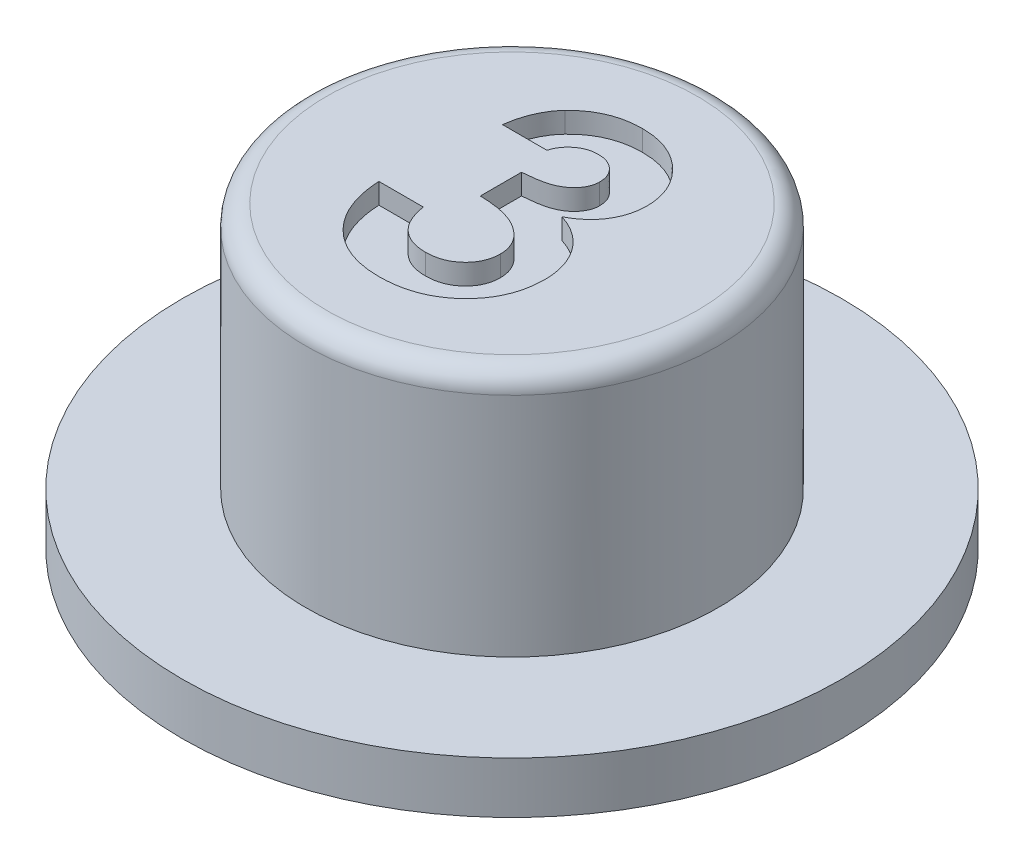
from build123d import *

# Parameters (mm, degrees)
SKETCH2_W          = 2.5
SKETCH2_H          = 3.5
CUT_EXTRUDE1_DEPTH = 3.5
FILLET1_R          = 0.5
CUT_EXTRUDE2_DEPTH = 0.5


with BuildPart() as part:
    # Sketch1 → Revolve1 (revolve)
    with BuildSketch(Plane.XY):
        Polygon((0, 7.25), (5, 7.25), (5, 1.25), (8, 1.25), (8, 0), (0, 0), align=None)
    revolve(axis=Axis((0, 7.25, 0), (0, -1, 0)))

    # Sketch2 → Cut-Extrude1 (cut)
    with BuildSketch(Plane.XZ):
        Rectangle(SKETCH2_W, SKETCH2_H)
    extrude(amount=-CUT_EXTRUDE1_DEPTH, mode=Mode.SUBTRACT)

    # Fillet1
    fillet1_edges = [part.edges().sort_by_distance(p)[0] for p in [
        (-5, 7.25, 0),
    ]]
    fillet(fillet1_edges, radius=FILLET1_R)

    # Sketch3 → Cut-Extrude2 (cut)
    with BuildSketch(Plane(origin=(0, 7.25, 0), x_dir=(1, 0, 0), z_dir=(0, 1, 0))):
        with BuildLine():
            Line((-0.692307692, 1.538461538), (-1.769230769, 1.538461538))
            add(Edge.make_bspline(
                [(-1.769230769, 1.538461538), (-1.761627283, 1.592293081), (-1.746721151, 1.697826255), (-1.711052772, 1.850612001), (-1.668389541, 1.995539737), (-1.615126677, 2.132150507), (-1.552658003, 2.26068766), (-1.481618755, 2.381592272), (-1.401240972, 2.494345399), (-1.339630551, 2.56226833), (-1.308894231, 2.596153846)],
                knots=[0, 0, 0, 0, 1.111473889, 2.178970933, 3.205615836, 4.199322666, 5.174200091, 6.12565194, 7.064921805, 8, 8, 8, 8], degree=3))
            add(Edge.make_bspline(
                [(-1.308894231, 2.596153846), (-1.264561162, 2.64086333), (-1.177185342, 2.728981023), (-1.0311701, 2.841850054), (-0.87811916, 2.939530525), (-0.714963019, 3.016972309), (-0.54424051, 3.079652462), (-0.364593988, 3.121754862), (-0.176757553, 3.149690176), (-0.048582817, 3.152441902), (0.016826923, 3.153846154)],
                knots=[0, 0, 0, 0, 1.01925491, 2.00884431, 2.983262333, 3.955970413, 4.92937149, 5.924503185, 6.940838805, 8, 8, 8, 8], degree=3))
            add(Edge.make_bspline(
                [(0.016826923, 3.153846154), (0.074979548, 3.152473284), (0.189295889, 3.1497745), (0.357312147, 3.12811012), (0.517501588, 3.09011321), (0.671557461, 3.040433102), (0.817214107, 2.972835014), (0.957686309, 2.894368021), (1.089049269, 2.798124993), (1.21161035, 2.689380057), (1.324206079, 2.571761763), (1.421714474, 2.44603748), (1.50554419, 2.315565593), (1.574608788, 2.179262127), (1.627710079, 2.03689644), (1.66456395, 1.889290961), (1.688685703, 1.73677139), (1.69108886, 1.633105893), (1.692307692, 1.580528846)],
                knots=[0, 0, 0, 0, 1.091422571, 2.145516843, 3.172569842, 4.178562979, 5.178154469, 6.181868002, 7.194278174, 8.227918432, 9.254613415, 10.245994977, 11.209837596, 12.161663635, 13.10878368, 14.055455738, 15.013766427, 16, 16, 16, 16], degree=3))
            add(Edge.make_bspline(
                [(1.692307692, 1.580528846), (1.689806575, 1.515416552), (1.684882644, 1.387230464), (1.644478223, 1.1996206), (1.581234318, 1.02023209), (1.489872345, 0.851574848), (1.37564661, 0.694107866), (1.235495458, 0.553095736), (1.073410758, 0.42632758), (0.951731615, 0.358202358), (0.889423077, 0.323317308)],
                knots=[0, 0, 0, 0, 0.992805628, 1.954529043, 2.915727527, 3.886831945, 4.871318353, 5.87440735, 6.911542536, 8, 8, 8, 8], degree=3))
            add(Edge.make_bspline(
                [(0.889423077, 0.323317308), (0.932190702, 0.309275796), (1.016227167, 0.281684855), (1.135674897, 0.227344809), (1.249256039, 0.167960147), (1.355014768, 0.098970823), (1.45400298, 0.02316646), (1.545617233, -0.060100944), (1.6304049, -0.150649828), (1.706981857, -0.248978177), (1.774946898, -0.353513419), (1.83592831, -0.461840853), (1.886119412, -0.575603284), (1.928637524, -0.693501468), (1.961008393, -0.816595012), (1.983800378, -0.944406938), (1.996974705, -1.0766457), (1.998984014, -1.166237381), (2, -1.211538462)],
                knots=[0, 0, 0, 0, 1.059543567, 2.081955587, 3.086750234, 4.076226789, 5.052108497, 6.020845489, 6.989030705, 7.970690546, 8.952259656, 9.923888338, 10.895517021, 11.877585046, 12.873342345, 13.889638361, 14.932918083, 16, 16, 16, 16], degree=3))
            add(Edge.make_bspline(
                [(2, -1.211538462), (1.99794046, -1.278112657), (1.993879466, -1.409383412), (1.96806157, -1.602731801), (1.919993298, -1.787072311), (1.856756824, -1.964526059), (1.772406231, -2.132802181), (1.673139763, -2.295762385), (1.55112133, -2.447755255), (1.415518792, -2.59279909), (1.264924269, -2.72466645), (1.101655307, -2.838989517), (0.92930205, -2.937099049), (0.746774068, -3.016747163), (0.554134775, -3.07808532), (0.351813548, -3.122423367), (0.138960288, -3.149550117), (-0.006328716, -3.152393843), (-0.080528846, -3.153846154)],
                knots=[0, 0, 0, 0, 1.005138573, 1.981928558, 2.936866704, 3.876260664, 4.820238198, 5.773547, 6.751179199, 7.756627054, 8.768222608, 9.766606018, 10.760583154, 11.757261445, 12.767156078, 13.807575856, 14.880313354, 16, 16, 16, 16], degree=3))
            add(Edge.make_bspline(
                [(-0.080528846, -3.153846154), (-0.150720973, -3.152314938), (-0.287972388, -3.149320847), (-0.488731308, -3.123405473), (-0.679533658, -3.081601873), (-0.860866369, -3.022676231), (-1.032027879, -2.946259745), (-1.194570348, -2.855264855), (-1.345250276, -2.744443189), (-1.485746535, -2.618797446), (-1.612942493, -2.477830056), (-1.726625726, -2.324806459), (-1.824289498, -2.15914477), (-1.90633433, -1.981552763), (-1.972118816, -1.791718889), (-2.024009425, -1.590029185), (-2.060255866, -1.376089611), (-2.071294795, -1.228894633), (-2.076923077, -1.153846154)],
                knots=[0, 0, 0, 0, 1.066544725, 2.085487077, 3.070979577, 4.031932826, 4.977951092, 5.916076795, 6.857635327, 7.814973522, 8.776389752, 9.738577119, 10.707772778, 11.69409279, 12.707140348, 13.757286496, 14.856535458, 16, 16, 16, 16], degree=3))
            Line((-2.076923077, -1.153846154), (-1, -1.153846154))
            add(Edge.make_bspline(
                [(-1, -1.153846154), (-0.993175651, -1.191581514), (-0.979883441, -1.265081025), (-0.953957801, -1.371491977), (-0.920173075, -1.469715859), (-0.881109526, -1.56062568), (-0.838915012, -1.645415056), (-0.78793395, -1.720952506), (-0.731901962, -1.78928918), (-0.651047396, -1.870528571), (-0.535460225, -1.953998654), (-0.37937925, -2.026538127), (-0.205753946, -2.069055171), (-0.084372543, -2.074242119), (-0.021634615, -2.076923077)],
                knots=[0, 0, 0, 0, 0.928156231, 1.807827665, 2.648129825, 3.438902246, 4.202261636, 4.936546065, 5.639352463, 6.338805438, 7.70633318, 9.064371875, 10.482673459, 12, 12, 12, 12], degree=3))
            add(Edge.make_bspline(
                [(-0.021634615, -2.076923077), (0.011656347, -2.076352192), (0.076865893, -2.075233957), (0.172649007, -2.062839815), (0.26389591, -2.042426653), (0.350776553, -2.014685923), (0.433844025, -1.979911184), (0.511511237, -1.935071238), (0.585361242, -1.8829384), (0.654591223, -1.824327251), (0.718561152, -1.760462079), (0.771787895, -1.689742251), (0.820433287, -1.617878267), (0.856411769, -1.54016853), (0.88793667, -1.460794654), (0.90723152, -1.376875618), (0.921800518, -1.290171816), (0.92264721, -1.23083554), (0.923076923, -1.200721154)],
                knots=[0, 0, 0, 0, 1.110435564, 2.175094844, 3.216326037, 4.226890168, 5.215276772, 6.21526065, 7.213097102, 8.228249917, 9.239874822, 10.221364777, 11.178138315, 12.128914389, 13.072518965, 14.022636769, 14.996447288, 16, 16, 16, 16], degree=3))
            add(Edge.make_bspline(
                [(0.923076923, -1.200721154), (0.921936114, -1.167785942), (0.919665025, -1.102219481), (0.901109988, -1.006539018), (0.871807663, -0.914502124), (0.831103154, -0.826516381), (0.776746819, -0.742906088), (0.71260695, -0.66199377), (0.633630386, -0.587990767), (0.546982519, -0.514841041), (0.446505033, -0.451076542), (0.337091322, -0.392231279), (0.215865824, -0.345408616), (0.085787762, -0.303587306), (-0.055603411, -0.27304167), (-0.207429711, -0.250862562), (-0.369446217, -0.234353653), (-0.481126301, -0.231985178), (-0.538461538, -0.230769231)],
                knots=[0, 0, 0, 0, 0.809814727, 1.612155564, 2.388397, 3.182215007, 3.988903953, 4.837162975, 5.715530372, 6.646997145, 7.623086902, 8.637258368, 9.698941581, 10.815059213, 11.996518529, 13.252603015, 14.589518788, 16, 16, 16, 16], degree=3))
            Line((-0.538461538, -0.230769231), (-0.538461538, 0.769230769))
            add(Edge.make_bspline(
                [(-0.538461538, 0.769230769), (-0.467075758, 0.775310211), (-0.333527098, 0.786683642), (-0.148154398, 0.813280806), (0.007905519, 0.848832295), (0.138403557, 0.891723242), (0.246760767, 0.946806392), (0.341421027, 1.007615757), (0.42294692, 1.078236948), (0.491847236, 1.156564051), (0.546965345, 1.240680013), (0.585974732, 1.329277425), (0.611734493, 1.419614974), (0.614175229, 1.481403134), (0.615384615, 1.512019231)],
                knots=[0, 0, 0, 0, 1.70044513, 3.18119609, 4.440695891, 5.496282586, 6.431922213, 7.318171381, 8.16090191, 8.983045123, 9.787564368, 10.536848927, 11.275007137, 12, 12, 12, 12], degree=3))
            add(Edge.make_bspline(
                [(0.615384615, 1.512019231), (0.613298077, 1.551082046), (0.609225595, 1.627324392), (0.577596497, 1.73644325), (0.522691967, 1.833713668), (0.449074632, 1.918930961), (0.35936935, 1.990110831), (0.254219034, 2.041786203), (0.135905452, 2.072147791), (0.052665473, 2.075295265), (0.009615385, 2.076923077)],
                knots=[0, 0, 0, 0, 1.009664648, 1.970651636, 2.907870547, 3.878035693, 4.867062054, 5.849714035, 6.887914197, 8, 8, 8, 8], degree=3))
            add(Edge.make_bspline(
                [(0.009615385, 2.076923077), (-0.02940468, 2.07500243), (-0.106832439, 2.071191279), (-0.220054998, 2.042745855), (-0.327578707, 1.994861524), (-0.427177053, 1.928831853), (-0.517412316, 1.849533017), (-0.591469432, 1.755620006), (-0.653066629, 1.652719311), (-0.679176059, 1.57669677), (-0.692307692, 1.538461538)],
                knots=[0, 0, 0, 0, 0.98818071, 1.960853194, 2.938124878, 3.957524365, 4.978590984, 5.968022688, 6.978025184, 8, 8, 8, 8], degree=3))
        make_face()
    extrude(amount=-CUT_EXTRUDE2_DEPTH, mode=Mode.SUBTRACT)


solid = part.part
